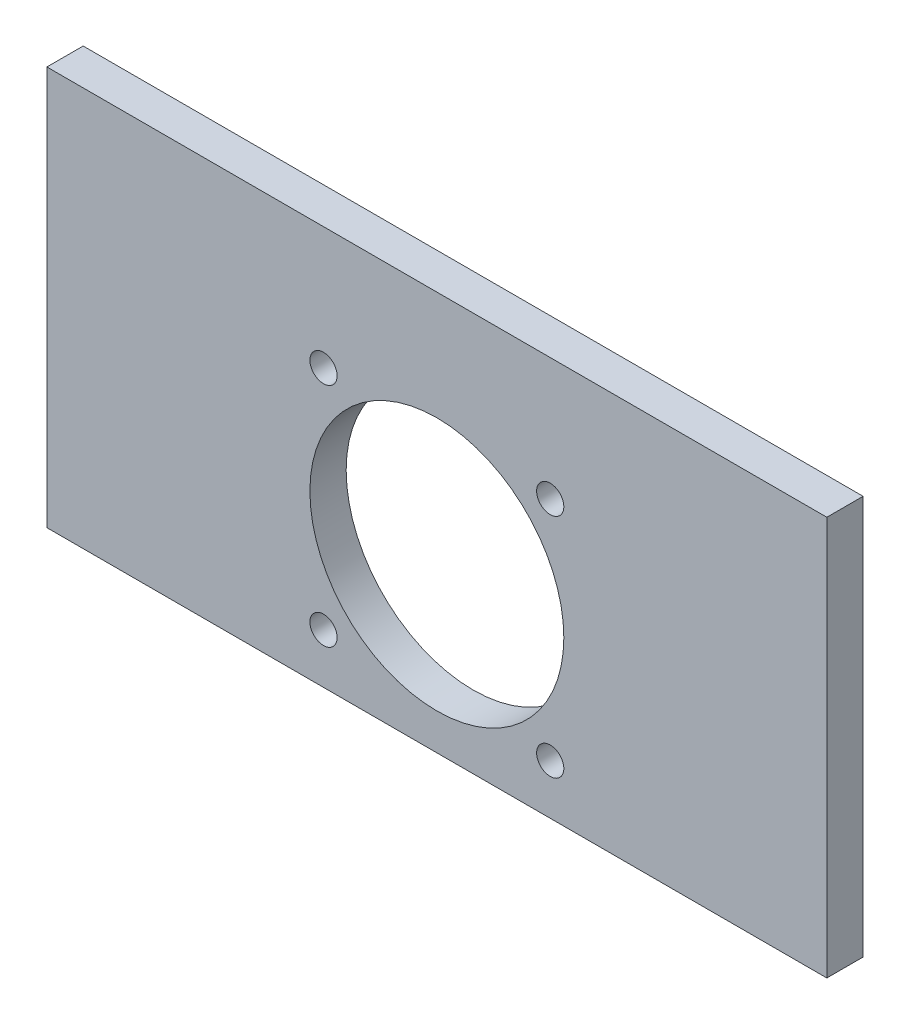
from build123d import *

# Parameters (mm, degrees)
SKETCH1_W           = 86
SKETCH1_H           = 44
BOSS_EXTRUDE1_DEPTH = 4
SKETCH2_R           = 14
CUT_EXTRUDE1_DEPTH  = 4
SKETCH3_R           = 1.5
CUT_EXTRUDE3_DEPTH  = 4


with BuildPart() as part:
    # Sketch1 → Boss-Extrude1 (new body)
    with BuildSketch(Plane.XY):
        with Locations((43, 22)):
            Rectangle(SKETCH1_W, SKETCH1_H)
    extrude(amount=BOSS_EXTRUDE1_DEPTH)

    # Sketch2 → Cut-Extrude1 (cut)
    with BuildSketch(Plane.XY.offset(4)):
        with Locations((43, 18)):
            Circle(SKETCH2_R)
    extrude(amount=-CUT_EXTRUDE1_DEPTH, mode=Mode.SUBTRACT)

    # Sketch3 → Cut-Extrude3 (cut)
    with BuildSketch(Plane.XY.offset(4)):
        with Locations((30.5, 30.5)):
            Circle(SKETCH3_R)
        with Locations((55.5, 30.5)):
            Circle(SKETCH3_R)
        with Locations((55.5, 5.5)):
            Circle(SKETCH3_R)
        with Locations((30.5, 5.5)):
            Circle(SKETCH3_R)
    extrude(amount=-CUT_EXTRUDE3_DEPTH, mode=Mode.SUBTRACT)


solid = part.part
